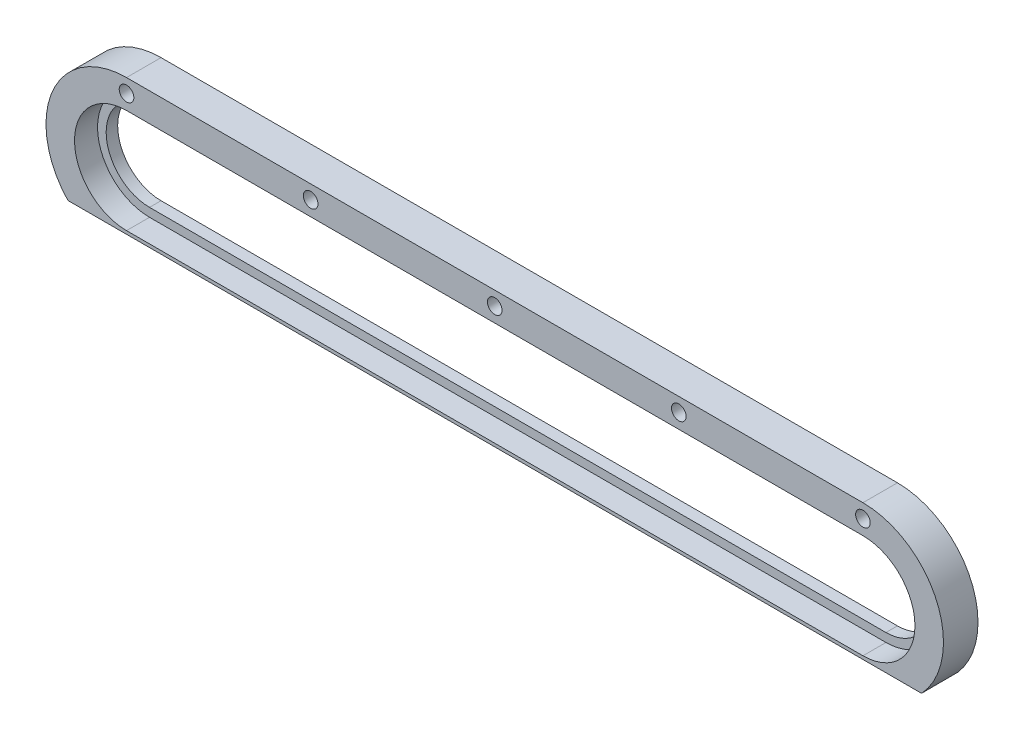
from build123d import *

# Parameters (mm, degrees)
SKETCH1_W              = 247.65
SKETCH1_H              = 44.45
BOSS_EXTRUDE1_DEPTH    = 9.525
CUT_EXTRUDE1_DEPTH     = 6.35
CUT_EXTRUDE3_DEPTH     = 126.963898598
CUT_EXTRUDE2_DEPTH     = 127.163809688
F_10_32_TAPPED_HOLE1_D = 4.0386
CHAMFER2_SIZE          = 6.985


with BuildPart() as part:
    # Sketch1 → Boss-Extrude1 (new body)
    with BuildSketch(Plane.XY):
        Rectangle(SKETCH1_W, SKETCH1_H)
    extrude(amount=BOSS_EXTRUDE1_DEPTH)

    # Sketch2 → Cut-Extrude1 (cut)
    with BuildSketch(Plane.XY.offset(9.525)):
        with BuildLine():
            Line((101.6, -14.351), (-101.6, -14.351))
            ThreePointArc((-101.6, -14.351), (-115.951, 0), (-101.6, 14.351))
            Line((-101.6, 14.351), (101.6, 14.351))
            ThreePointArc((101.6, 14.351), (115.951, 0), (101.6, -14.351))
        make_face()
    extrude(amount=-CUT_EXTRUDE1_DEPTH, mode=Mode.SUBTRACT)

    # Sketch14 → Cut-Extrude3 (cut, through all)
    with BuildSketch(Plane.XY.offset(3.175)):
        with BuildLine():
            Line((101.6, 11.96975), (-101.6, 11.96975))
            ThreePointArc((-101.6, 11.96975), (-113.56975, 0), (-101.6, -11.96975))
            Line((-101.6, -11.96975), (101.6, -11.96975))
            ThreePointArc((101.6, -11.96975), (113.56975, 0), (101.6, 11.96975))
        make_face()
    extrude(amount=-CUT_EXTRUDE3_DEPTH, mode=Mode.SUBTRACT)

    # Sketch3 → Cut-Extrude2 (cut, through all)
    with BuildSketch(Plane.XY.offset(9.525)):
        with BuildLine():
            ThreePointArc((-123.825, -1.74e-07), (-117.315448274, 15.71544815), (-101.6, 22.225))
            Line((-101.6, 22.225), (-123.825, 22.225))
            Line((-123.825, 22.225), (-123.825, -1.74e-07))
        make_face()
        with BuildLine():
            ThreePointArc((-101.6, -22.225), (-117.31544815, -15.715448274), (-123.825, -1.74e-07))
            Line((-123.825, -1.74e-07), (-123.825, -22.225))
            Line((-123.825, -22.225), (-101.6, -22.225))
        make_face()
        with BuildLine():
            Line((123.825, -22.225), (123.825, -6.4e-08))
            ThreePointArc((123.825, -6.4e-08), (117.315448189, -15.715448235), (101.6, -22.225))
            Line((101.6, -22.225), (123.825, -22.225))
        make_face()
        with BuildLine():
            Line((123.825, 22.225), (101.6, 22.225))
            ThreePointArc((101.6, 22.225), (117.315448235, 15.715448189), (123.825, -6.4e-08))
            Line((123.825, -6.4e-08), (123.825, 22.225))
        make_face()
    extrude(amount=-CUT_EXTRUDE2_DEPTH, mode=Mode.SUBTRACT)

    # #10-32 Tapped Hole1 (through all)
    with Locations(Plane.XY.offset(9.525)):
        with Locations((-101.6, 18.415), (-50.8, 18.415), (0, 18.415), (50.8, 18.415), (101.6, 18.415), (101.6, -18.415), (50.8, -18.415), (0, -18.415), (-50.8, -18.415), (-101.6, -18.415)):
            Hole(F_10_32_TAPPED_HOLE1_D / 2)

    # Chamfer2
    # the kernel refuses this chamfer: 6.985 mm, written as the material it takes off along each edge
    with BuildSketch(Plane(origin=(-119.563205671, -22.225, 9.525), x_dir=(0, 0.9996219169112968, 0.027495876610586303), z_dir=(1, 0, 0))) as chamfer2_piece_1:
        Polygon((CHAMFER2_SIZE * 0.999621916911, -CHAMFER2_SIZE * 0.0274958766106), (-CHAMFER2_SIZE * 0.0274958766106, -CHAMFER2_SIZE * 0.999621916911), (0, 0), align=None)
    extrude(amount=239.126411342, mode=Mode.SUBTRACT)


solid = part.part
